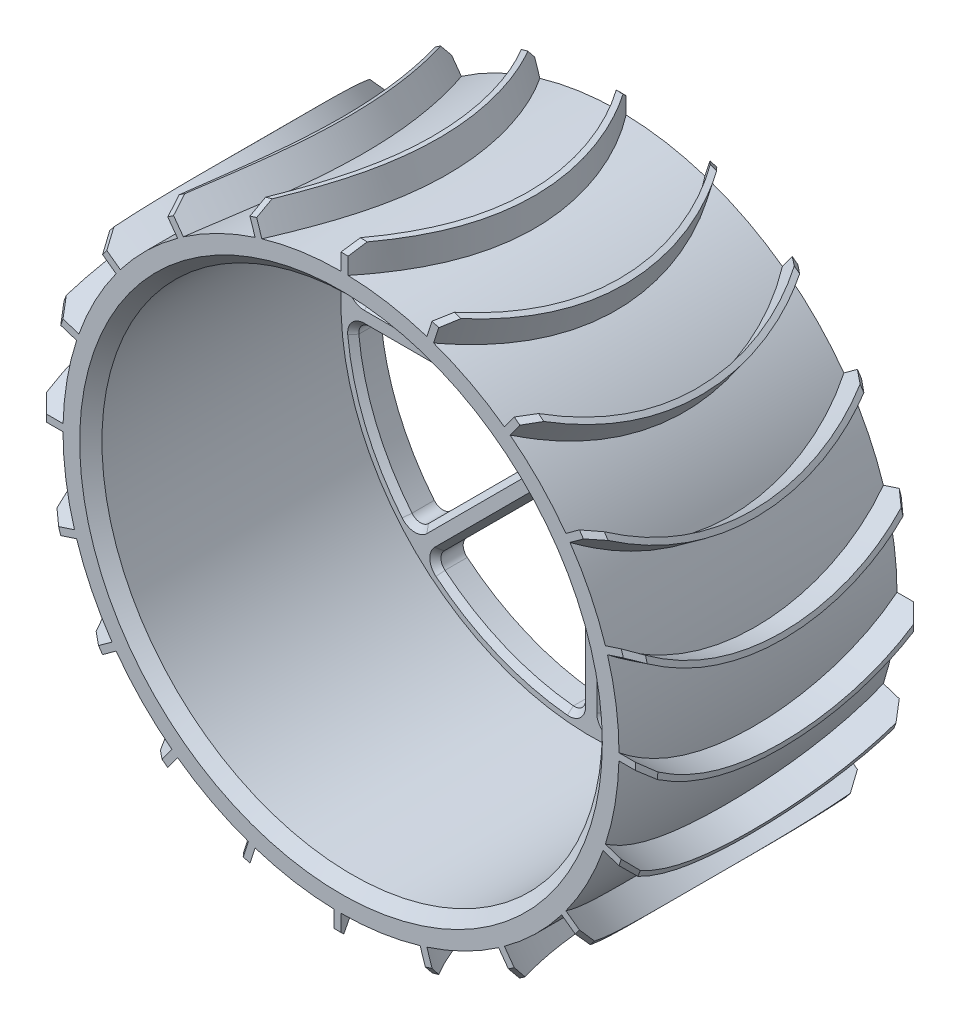
from build123d import *

# Parameters (mm, degrees)
SKETCH1_R                    = 50
BOSS_EXTRUDE1_DEPTH          = 25
BOSS_EXTRUDE2_REACH          = 77
BOSS_EXTRUDE2_END_RADIUS     = 55
CHAMFER1_SIZE                = 2
CIRPATTERN1_COUNT            = 20
CHAMFER1_OF_CIRPATTERN1_SIZE = 2
CUT_EXTRUDE1_DEPTH           = 82.673087038
CUT_EXTRUDE1_DEPTH_BACK      = 20
SKETCH4_R                    = 45
CUT_EXTRUDE2_DEPTH           = 82.673087038
CHAMFER2_SIZE                = 1
CIRPATTERN2_COUNT            = 8
CHAMFER2_OF_CIRPATTERN2_SIZE = 1
SKETCH2_R                    = 1.6
SKETCH2_R_2                  = 2.5
CUT_EXTRUDE3_DEPTH           = 82.673087038
CHAMFER3_SIZE                = 2
CHAMFER4_SIZE                = 1


with BuildPart() as part:
    # Sketch1 → Boss-Extrude1 (new, symmetric)
    with BuildSketch(Plane.XY):
        Circle(SKETCH1_R)
    extrude(amount=BOSS_EXTRUDE1_DEPTH, both=True)

    # Boss-Extrude2: up to this cylinder (the profile starts inside it)
    boss_extrude2_end = Plane(origin=(0, 0, 24.490535), z_dir=(0, 0, -1)) * Cylinder(BOSS_EXTRUDE2_END_RADIUS, 265, mode=Mode.PRIVATE)
    # Sketch3 → Boss-Extrude2 (add, up to the surface)
    with BuildSketch(Plane(origin=(0, 0, 0), x_dir=(1, 0, 0), z_dir=(0, 1, 0)), mode=Mode.PRIVATE) as boss_extrude2_sk1:
        with BuildLine():
            ThreePointArc((0, 25), (8.775010008, 0), (0, -25))
            Line((0, -25), (1.271163627, -25))
            ThreePointArc((1.271163627, -25), (9.775010008, 0), (1.271163627, 25))
            Line((1.271163627, 25), (0, 25))
        make_face()
    boss_extrude2_tool1 = extrude(boss_extrude2_sk1.sketch, amount=BOSS_EXTRUDE2_REACH, mode=Mode.PRIVATE) & boss_extrude2_end
    boss_extrude2 = boss_extrude2_tool1.solids().sort_by_distance((0.635582, 0, 24.490535))[0]
    add(boss_extrude2)

    # Chamfer1
    # the kernel refuses this chamfer: 2 mm, written as the material it takes off along each edge
    with BuildSketch(Plane(origin=(0, 0, -25), x_dir=(-0.0933795104694511, 0.9956305876300132, 0), z_dir=(-0.9956305876300132, -0.0933795104694511, 0))) as chamfer1_piece_1:
        Polygon((55, -CHAMFER1_SIZE), (55 - CHAMFER1_SIZE, 0), (55, 0), align=None)
    revolve(axis=Axis((0, 0, -25), (0, 0, -1)), revolution_arc=12.040457702, mode=Mode.SUBTRACT)
    with BuildSketch(Plane(origin=(0, 0, 25), x_dir=(-0.09337951046945088, 0.9956305876300133, 0), z_dir=(-0.9956305876300133, -0.09337951046945088, 0))) as chamfer1_piece_2:
        Polygon((55 - CHAMFER1_SIZE, 0), (55, CHAMFER1_SIZE), (55, 0), align=None)
    revolve(axis=Axis((0, 0, 25), (0, 0, -1)), revolution_arc=12.040457702, mode=Mode.SUBTRACT)

    # CirPattern1: Boss-Extrude2 ×20 about axis
    cirpattern1_axis = Axis((0, 0, 0), (0, 0, 1))
    for i in range(1, CIRPATTERN1_COUNT):
        add(boss_extrude2.rotate(cirpattern1_axis, i * 360 / CIRPATTERN1_COUNT))

    # Chamfer1 of CirPattern1
    # the kernel refuses this chamfer: 2 mm, written as the material it takes off along each edge
    with BuildSketch(Plane(origin=(0, 0, -25), x_dir=(-0.39647596361761267, 0.9180451025268234, 0), z_dir=(-0.9180451025268234, -0.39647596361761267, 0))) as chamfer1_of_cirpattern1_piece_1:
        Polygon((55, -CHAMFER1_OF_CIRPATTERN1_SIZE), (55 - CHAMFER1_OF_CIRPATTERN1_SIZE, 0), (55, 0), align=None)
    revolve(axis=Axis((0, 0, -25), (0, 0, -1)), revolution_arc=12.040457702, mode=Mode.SUBTRACT)
    with BuildSketch(Plane(origin=(0, 0, 25), x_dir=(-0.3964759636176123, 0.9180451025268235, 0), z_dir=(-0.9180451025268235, -0.3964759636176123, 0))) as chamfer1_of_cirpattern1_piece_2:
        Polygon((55 - CHAMFER1_OF_CIRPATTERN1_SIZE, 0), (55, CHAMFER1_OF_CIRPATTERN1_SIZE), (55, 0), align=None)
    revolve(axis=Axis((0, 0, 25), (0, 0, -1)), revolution_arc=12.040457702, mode=Mode.SUBTRACT)
    with BuildSketch(Plane(origin=(0, 0, -25), x_dir=(-0.6607625870364097, 0.7505949663919623, 0), z_dir=(-0.7505949663919623, -0.6607625870364097, 0))) as chamfer1_of_cirpattern1_piece_3:
        Polygon((55, -CHAMFER1_OF_CIRPATTERN1_SIZE), (55 - CHAMFER1_OF_CIRPATTERN1_SIZE, 0), (55, 0), align=None)
    revolve(axis=Axis((0, 0, -25), (0, 0, -1)), revolution_arc=12.040457702, mode=Mode.SUBTRACT)
    with BuildSketch(Plane(origin=(0, 0, 25), x_dir=(-0.6607625870364093, 0.7505949663919625, 0), z_dir=(-0.7505949663919625, -0.6607625870364093, 0))) as chamfer1_of_cirpattern1_piece_4:
        Polygon((55 - CHAMFER1_OF_CIRPATTERN1_SIZE, 0), (55, CHAMFER1_OF_CIRPATTERN1_SIZE), (55, 0), align=None)
    revolve(axis=Axis((0, 0, 25), (0, 0, -1)), revolution_arc=12.040457702, mode=Mode.SUBTRACT)
    with BuildSketch(Plane(origin=(0, 0, -25), x_dir=(-0.8603691646324303, 0.509671365244011, 0), z_dir=(-0.509671365244011, -0.8603691646324303, 0))) as chamfer1_of_cirpattern1_piece_5:
        Polygon((55, -CHAMFER1_OF_CIRPATTERN1_SIZE), (55 - CHAMFER1_OF_CIRPATTERN1_SIZE, 0), (55, 0), align=None)
    revolve(axis=Axis((0, 0, -25), (0, 0, -1)), revolution_arc=12.040457702, mode=Mode.SUBTRACT)
    with BuildSketch(Plane(origin=(0, 0, 25), x_dir=(-0.8603691646324301, 0.5096713652440111, 0), z_dir=(-0.5096713652440111, -0.8603691646324301, 0))) as chamfer1_of_cirpattern1_piece_6:
        Polygon((55 - CHAMFER1_OF_CIRPATTERN1_SIZE, 0), (55, CHAMFER1_OF_CIRPATTERN1_SIZE), (55, 0), align=None)
    revolve(axis=Axis((0, 0, 25), (0, 0, -1)), revolution_arc=12.040457702, mode=Mode.SUBTRACT)
    with BuildSketch(Plane(origin=(0, 0, -25), x_dir=(-0.9757568138497709, 0.2188575797767665, 0), z_dir=(-0.2188575797767665, -0.9757568138497709, 0))) as chamfer1_of_cirpattern1_piece_7:
        Polygon((55, -CHAMFER1_OF_CIRPATTERN1_SIZE), (55 - CHAMFER1_OF_CIRPATTERN1_SIZE, 0), (55, 0), align=None)
    revolve(axis=Axis((0, 0, -25), (0, 0, -1)), revolution_arc=12.040457702, mode=Mode.SUBTRACT)
    with BuildSketch(Plane(origin=(0, 0, 25), x_dir=(-0.9757568138497706, 0.2188575797767667, 0), z_dir=(-0.2188575797767667, -0.9757568138497706, 0))) as chamfer1_of_cirpattern1_piece_8:
        Polygon((55 - CHAMFER1_OF_CIRPATTERN1_SIZE, 0), (55, CHAMFER1_OF_CIRPATTERN1_SIZE), (55, 0), align=None)
    revolve(axis=Axis((0, 0, 25), (0, 0, -1)), revolution_arc=12.040457702, mode=Mode.SUBTRACT)
    with BuildSketch(Plane(origin=(0, 0, -25), x_dir=(-0.9956305876300132, -0.09337951046945099, 0), z_dir=(0.09337951046945099, -0.9956305876300132, 0))) as chamfer1_of_cirpattern1_piece_9:
        Polygon((55, -CHAMFER1_OF_CIRPATTERN1_SIZE), (55 - CHAMFER1_OF_CIRPATTERN1_SIZE, 0), (55, 0), align=None)
    revolve(axis=Axis((0, 0, -25), (0, 0, -1)), revolution_arc=12.040457702, mode=Mode.SUBTRACT)
    with BuildSketch(Plane(origin=(0, 0, 25), x_dir=(-0.9956305876300132, -0.09337951046945075, 0), z_dir=(0.09337951046945075, -0.9956305876300132, 0))) as chamfer1_of_cirpattern1_piece_10:
        Polygon((55 - CHAMFER1_OF_CIRPATTERN1_SIZE, 0), (55, CHAMFER1_OF_CIRPATTERN1_SIZE), (55, 0), align=None)
    revolve(axis=Axis((0, 0, 25), (0, 0, -1)), revolution_arc=12.040457702, mode=Mode.SUBTRACT)
    with BuildSketch(Plane(origin=(0, 0, -25), x_dir=(-0.9180451025268233, -0.39647596361761267, 0), z_dir=(0.39647596361761267, -0.9180451025268233, 0))) as chamfer1_of_cirpattern1_piece_11:
        Polygon((55, -CHAMFER1_OF_CIRPATTERN1_SIZE), (55 - CHAMFER1_OF_CIRPATTERN1_SIZE, 0), (55, 0), align=None)
    revolve(axis=Axis((0, 0, -25), (0, 0, -1)), revolution_arc=12.040457702, mode=Mode.SUBTRACT)
    with BuildSketch(Plane(origin=(0, 0, 25), x_dir=(-0.9180451025268236, -0.3964759636176123, 0), z_dir=(0.3964759636176123, -0.9180451025268236, 0))) as chamfer1_of_cirpattern1_piece_12:
        Polygon((55 - CHAMFER1_OF_CIRPATTERN1_SIZE, 0), (55, CHAMFER1_OF_CIRPATTERN1_SIZE), (55, 0), align=None)
    revolve(axis=Axis((0, 0, 25), (0, 0, -1)), revolution_arc=12.040457702, mode=Mode.SUBTRACT)
    with BuildSketch(Plane(origin=(0, 0, -25), x_dir=(-0.7505949663919622, -0.6607625870364099, 0), z_dir=(0.6607625870364099, -0.7505949663919622, 0))) as chamfer1_of_cirpattern1_piece_13:
        Polygon((55, -CHAMFER1_OF_CIRPATTERN1_SIZE), (55 - CHAMFER1_OF_CIRPATTERN1_SIZE, 0), (55, 0), align=None)
    revolve(axis=Axis((0, 0, -25), (0, 0, -1)), revolution_arc=12.040457702, mode=Mode.SUBTRACT)
    with BuildSketch(Plane(origin=(0, 0, 25), x_dir=(-0.7505949663919624, -0.6607625870364097, 0), z_dir=(0.6607625870364097, -0.7505949663919624, 0))) as chamfer1_of_cirpattern1_piece_14:
        Polygon((55 - CHAMFER1_OF_CIRPATTERN1_SIZE, 0), (55, CHAMFER1_OF_CIRPATTERN1_SIZE), (55, 0), align=None)
    revolve(axis=Axis((0, 0, 25), (0, 0, -1)), revolution_arc=12.040457702, mode=Mode.SUBTRACT)
    with BuildSketch(Plane(origin=(0, 0, -25), x_dir=(-0.5096713652440107, -0.8603691646324305, 0), z_dir=(0.8603691646324305, -0.5096713652440107, 0))) as chamfer1_of_cirpattern1_piece_15:
        Polygon((55, -CHAMFER1_OF_CIRPATTERN1_SIZE), (55 - CHAMFER1_OF_CIRPATTERN1_SIZE, 0), (55, 0), align=None)
    revolve(axis=Axis((0, 0, -25), (0, 0, -1)), revolution_arc=12.040457702, mode=Mode.SUBTRACT)
    with BuildSketch(Plane(origin=(0, 0, 25), x_dir=(-0.5096713652440111, -0.8603691646324303, 0), z_dir=(0.8603691646324303, -0.5096713652440111, 0))) as chamfer1_of_cirpattern1_piece_16:
        Polygon((55 - CHAMFER1_OF_CIRPATTERN1_SIZE, 0), (55, CHAMFER1_OF_CIRPATTERN1_SIZE), (55, 0), align=None)
    revolve(axis=Axis((0, 0, 25), (0, 0, -1)), revolution_arc=12.040457702, mode=Mode.SUBTRACT)
    with BuildSketch(Plane(origin=(0, 0, -25), x_dir=(-0.21885757977676654, -0.9757568138497709, 0), z_dir=(0.9757568138497709, -0.21885757977676654, 0))) as chamfer1_of_cirpattern1_piece_17:
        Polygon((55, -CHAMFER1_OF_CIRPATTERN1_SIZE), (55 - CHAMFER1_OF_CIRPATTERN1_SIZE, 0), (55, 0), align=None)
    revolve(axis=Axis((0, 0, -25), (0, 0, -1)), revolution_arc=12.040457702, mode=Mode.SUBTRACT)
    with BuildSketch(Plane(origin=(0, 0, 25), x_dir=(-0.21885757977676693, -0.9757568138497708, 0), z_dir=(0.9757568138497708, -0.21885757977676693, 0))) as chamfer1_of_cirpattern1_piece_18:
        Polygon((55 - CHAMFER1_OF_CIRPATTERN1_SIZE, 0), (55, CHAMFER1_OF_CIRPATTERN1_SIZE), (55, 0), align=None)
    revolve(axis=Axis((0, 0, 25), (0, 0, -1)), revolution_arc=12.040457702, mode=Mode.SUBTRACT)
    with BuildSketch(Plane(origin=(0, 0, -25), x_dir=(0.09337951046945098, -0.9956305876300133, 0), z_dir=(0.9956305876300133, 0.09337951046945098, 0))) as chamfer1_of_cirpattern1_piece_19:
        Polygon((55, -CHAMFER1_OF_CIRPATTERN1_SIZE), (55 - CHAMFER1_OF_CIRPATTERN1_SIZE, 0), (55, 0), align=None)
    revolve(axis=Axis((0, 0, -25), (0, 0, -1)), revolution_arc=12.040457702, mode=Mode.SUBTRACT)
    with BuildSketch(Plane(origin=(0, 0, 25), x_dir=(0.09337951046945075, -0.9956305876300133, 0), z_dir=(0.9956305876300133, 0.09337951046945075, 0))) as chamfer1_of_cirpattern1_piece_20:
        Polygon((55 - CHAMFER1_OF_CIRPATTERN1_SIZE, 0), (55, CHAMFER1_OF_CIRPATTERN1_SIZE), (55, 0), align=None)
    revolve(axis=Axis((0, 0, 25), (0, 0, -1)), revolution_arc=12.040457702, mode=Mode.SUBTRACT)
    with BuildSketch(Plane(origin=(0, 0, -25), x_dir=(0.39647596361761245, -0.9180451025268234, 0), z_dir=(0.9180451025268234, 0.39647596361761245, 0))) as chamfer1_of_cirpattern1_piece_21:
        Polygon((55, -CHAMFER1_OF_CIRPATTERN1_SIZE), (55 - CHAMFER1_OF_CIRPATTERN1_SIZE, 0), (55, 0), align=None)
    revolve(axis=Axis((0, 0, -25), (0, 0, -1)), revolution_arc=12.040457702, mode=Mode.SUBTRACT)
    with BuildSketch(Plane(origin=(0, 0, 25), x_dir=(0.39647596361761206, -0.9180451025268236, 0), z_dir=(0.9180451025268236, 0.39647596361761206, 0))) as chamfer1_of_cirpattern1_piece_22:
        Polygon((55 - CHAMFER1_OF_CIRPATTERN1_SIZE, 0), (55, CHAMFER1_OF_CIRPATTERN1_SIZE), (55, 0), align=None)
    revolve(axis=Axis((0, 0, 25), (0, 0, -1)), revolution_arc=12.040457702, mode=Mode.SUBTRACT)
    with BuildSketch(Plane(origin=(0, 0, -25), x_dir=(0.66076258703641, -0.750594966391962, 0), z_dir=(0.750594966391962, 0.66076258703641, 0))) as chamfer1_of_cirpattern1_piece_23:
        Polygon((55, -CHAMFER1_OF_CIRPATTERN1_SIZE), (55 - CHAMFER1_OF_CIRPATTERN1_SIZE, 0), (55, 0), align=None)
    revolve(axis=Axis((0, 0, -25), (0, 0, -1)), revolution_arc=12.040457702, mode=Mode.SUBTRACT)
    with BuildSketch(Plane(origin=(0, 0, 25), x_dir=(0.6607625870364097, -0.7505949663919624, 0), z_dir=(0.7505949663919624, 0.6607625870364097, 0))) as chamfer1_of_cirpattern1_piece_24:
        Polygon((55 - CHAMFER1_OF_CIRPATTERN1_SIZE, 0), (55, CHAMFER1_OF_CIRPATTERN1_SIZE), (55, 0), align=None)
    revolve(axis=Axis((0, 0, 25), (0, 0, -1)), revolution_arc=12.040457702, mode=Mode.SUBTRACT)
    with BuildSketch(Plane(origin=(0, 0, -25), x_dir=(0.86036916463243, -0.5096713652440115, 0), z_dir=(0.5096713652440115, 0.86036916463243, 0))) as chamfer1_of_cirpattern1_piece_25:
        Polygon((55, -CHAMFER1_OF_CIRPATTERN1_SIZE), (55 - CHAMFER1_OF_CIRPATTERN1_SIZE, 0), (55, 0), align=None)
    revolve(axis=Axis((0, 0, -25), (0, 0, -1)), revolution_arc=12.040457702, mode=Mode.SUBTRACT)
    with BuildSketch(Plane(origin=(0, 0, 25), x_dir=(0.8603691646324296, -0.509671365244012, 0), z_dir=(0.509671365244012, 0.8603691646324296, 0))) as chamfer1_of_cirpattern1_piece_26:
        Polygon((55 - CHAMFER1_OF_CIRPATTERN1_SIZE, 0), (55, CHAMFER1_OF_CIRPATTERN1_SIZE), (55, 0), align=None)
    revolve(axis=Axis((0, 0, 25), (0, 0, -1)), revolution_arc=12.040457702, mode=Mode.SUBTRACT)
    with BuildSketch(Plane(origin=(0, 0, -25), x_dir=(0.9757568138497709, -0.2188575797767665, 0), z_dir=(0.2188575797767665, 0.9757568138497709, 0))) as chamfer1_of_cirpattern1_piece_27:
        Polygon((55, -CHAMFER1_OF_CIRPATTERN1_SIZE), (55 - CHAMFER1_OF_CIRPATTERN1_SIZE, 0), (55, 0), align=None)
    revolve(axis=Axis((0, 0, -25), (0, 0, -1)), revolution_arc=12.040457702, mode=Mode.SUBTRACT)
    with BuildSketch(Plane(origin=(0, 0, 25), x_dir=(0.9757568138497706, -0.2188575797767667, 0), z_dir=(0.2188575797767667, 0.9757568138497706, 0))) as chamfer1_of_cirpattern1_piece_28:
        Polygon((55 - CHAMFER1_OF_CIRPATTERN1_SIZE, 0), (55, CHAMFER1_OF_CIRPATTERN1_SIZE), (55, 0), align=None)
    revolve(axis=Axis((0, 0, 25), (0, 0, -1)), revolution_arc=12.040457702, mode=Mode.SUBTRACT)
    with BuildSketch(Plane(origin=(0, 0, -25), x_dir=(0.9956305876300132, 0.09337951046945087, 0), z_dir=(-0.09337951046945087, 0.9956305876300132, 0))) as chamfer1_of_cirpattern1_piece_29:
        Polygon((55, -CHAMFER1_OF_CIRPATTERN1_SIZE), (55 - CHAMFER1_OF_CIRPATTERN1_SIZE, 0), (55, 0), align=None)
    revolve(axis=Axis((0, 0, -25), (0, 0, -1)), revolution_arc=12.040457702, mode=Mode.SUBTRACT)
    with BuildSketch(Plane(origin=(0, 0, 25), x_dir=(0.9956305876300133, 0.09337951046945066, 0), z_dir=(-0.09337951046945066, 0.9956305876300133, 0))) as chamfer1_of_cirpattern1_piece_30:
        Polygon((55 - CHAMFER1_OF_CIRPATTERN1_SIZE, 0), (55, CHAMFER1_OF_CIRPATTERN1_SIZE), (55, 0), align=None)
    revolve(axis=Axis((0, 0, 25), (0, 0, -1)), revolution_arc=12.040457702, mode=Mode.SUBTRACT)
    with BuildSketch(Plane(origin=(0, 0, -25), x_dir=(0.9180451025268233, 0.3964759636176124, 0), z_dir=(-0.3964759636176124, 0.9180451025268233, 0))) as chamfer1_of_cirpattern1_piece_31:
        Polygon((55, -CHAMFER1_OF_CIRPATTERN1_SIZE), (55 - CHAMFER1_OF_CIRPATTERN1_SIZE, 0), (55, 0), align=None)
    revolve(axis=Axis((0, 0, -25), (0, 0, -1)), revolution_arc=12.040457702, mode=Mode.SUBTRACT)
    with BuildSketch(Plane(origin=(0, 0, 25), x_dir=(0.9180451025268237, 0.39647596361761206, 0), z_dir=(-0.39647596361761206, 0.9180451025268237, 0))) as chamfer1_of_cirpattern1_piece_32:
        Polygon((55 - CHAMFER1_OF_CIRPATTERN1_SIZE, 0), (55, CHAMFER1_OF_CIRPATTERN1_SIZE), (55, 0), align=None)
    revolve(axis=Axis((0, 0, 25), (0, 0, -1)), revolution_arc=12.040457702, mode=Mode.SUBTRACT)
    with BuildSketch(Plane(origin=(0, 0, -25), x_dir=(0.7505949663919622, 0.6607625870364099, 0), z_dir=(-0.6607625870364099, 0.7505949663919622, 0))) as chamfer1_of_cirpattern1_piece_33:
        Polygon((55, -CHAMFER1_OF_CIRPATTERN1_SIZE), (55 - CHAMFER1_OF_CIRPATTERN1_SIZE, 0), (55, 0), align=None)
    revolve(axis=Axis((0, 0, -25), (0, 0, -1)), revolution_arc=12.040457702, mode=Mode.SUBTRACT)
    with BuildSketch(Plane(origin=(0, 0, 25), x_dir=(0.7505949663919625, 0.6607625870364096, 0), z_dir=(-0.6607625870364096, 0.7505949663919625, 0))) as chamfer1_of_cirpattern1_piece_34:
        Polygon((55 - CHAMFER1_OF_CIRPATTERN1_SIZE, 0), (55, CHAMFER1_OF_CIRPATTERN1_SIZE), (55, 0), align=None)
    revolve(axis=Axis((0, 0, 25), (0, 0, -1)), revolution_arc=12.040457702, mode=Mode.SUBTRACT)
    with BuildSketch(Plane(origin=(0, 0, -25), x_dir=(0.5096713652440115, 0.86036916463243, 0), z_dir=(-0.86036916463243, 0.5096713652440115, 0))) as chamfer1_of_cirpattern1_piece_35:
        Polygon((55, -CHAMFER1_OF_CIRPATTERN1_SIZE), (55 - CHAMFER1_OF_CIRPATTERN1_SIZE, 0), (55, 0), align=None)
    revolve(axis=Axis((0, 0, -25), (0, 0, -1)), revolution_arc=12.040457702, mode=Mode.SUBTRACT)
    with BuildSketch(Plane(origin=(0, 0, 25), x_dir=(0.509671365244012, 0.8603691646324296, 0), z_dir=(-0.8603691646324296, 0.509671365244012, 0))) as chamfer1_of_cirpattern1_piece_36:
        Polygon((55 - CHAMFER1_OF_CIRPATTERN1_SIZE, 0), (55, CHAMFER1_OF_CIRPATTERN1_SIZE), (55, 0), align=None)
    revolve(axis=Axis((0, 0, 25), (0, 0, -1)), revolution_arc=12.040457702, mode=Mode.SUBTRACT)
    with BuildSketch(Plane(origin=(0, 0, -25), x_dir=(0.21885757977676662, 0.9757568138497708, 0), z_dir=(-0.9757568138497708, 0.21885757977676662, 0))) as chamfer1_of_cirpattern1_piece_37:
        Polygon((55 - CHAMFER1_OF_CIRPATTERN1_SIZE, 0), (55, -CHAMFER1_OF_CIRPATTERN1_SIZE), (55, 0), align=None)
    revolve(axis=Axis((0, 0, -25), (0, 0, -1)), revolution_arc=12.040457702, mode=Mode.SUBTRACT)
    with BuildSketch(Plane(origin=(0, 0, 25), x_dir=(0.21885757977676687, 0.9757568138497709, 0), z_dir=(-0.9757568138497709, 0.21885757977676687, 0))) as chamfer1_of_cirpattern1_piece_38:
        Polygon((55 - CHAMFER1_OF_CIRPATTERN1_SIZE, 0), (55, CHAMFER1_OF_CIRPATTERN1_SIZE), (55, 0), align=None)
    revolve(axis=Axis((0, 0, 25), (0, 0, -1)), revolution_arc=12.040457702, mode=Mode.SUBTRACT)

    # Sketch4 → Cut-Extrude1 (cut, two sides: drawn at the far end of the back side and taken through both)
    with BuildSketch(Plane.XY.offset(-CUT_EXTRUDE1_DEPTH_BACK)):
        Circle(SKETCH4_R)
    extrude(amount=CUT_EXTRUDE1_DEPTH + CUT_EXTRUDE1_DEPTH_BACK, mode=Mode.SUBTRACT)

    # Sketch4<3> → Cut-Extrude2 (cut, through all)
    with BuildSketch(Plane.XY):
        with BuildLine():
            ThreePointArc((-27.294144039, 33.226942399), (-16.455387592, 39.726819898), (-4.195121951, 42.794870625))
            ThreePointArc((-4.195121951, 42.794870625), (-2.656542502, 42.286005921), (-2, 40.804411526))
            Line((-2, 40.804411526), (-2, 14.485281374))
            ThreePointArc((-2, 14.485281374), (-4.469266271, 10.789763244), (-8.828427125, 11.656854249))
            Line((-8.828427125, 11.656854249), (-27.43886253, 30.267289655))
            ThreePointArc((-27.43886253, 30.267289655), (-28.022262318, 31.779180754), (-27.294144039, 33.226942399))
        make_face()
    cut_extrude2 = extrude(amount=-CUT_EXTRUDE2_DEPTH, mode=Mode.SUBTRACT)

    # Chamfer2
    chamfer2_edges = [part.edges().sort_by_distance(p)[0] for p in [
        (-28.022262318, 31.779180754, -20),
        (-18.133644827, 20.962071952, -20),
        (-4.469266271, 10.789763244, -20),
        (-2, 27.64484645, -20),
        (-2.656542502, 42.286005921, -20),
        (-16.455387592, 39.726819898, -20),
    ]]
    chamfer(chamfer2_edges, length=CHAMFER2_SIZE)

    # CirPattern2: Cut-Extrude2 ×8 about axis
    cirpattern2_axis = Axis((0, 0, 0), (0, 0, 1))
    for i in range(1, CIRPATTERN2_COUNT):
        add(cut_extrude2.rotate(cirpattern2_axis, i * 360 / CIRPATTERN2_COUNT), mode=Mode.SUBTRACT)

    # Chamfer2 of CirPattern2
    chamfer2_of_cirpattern2_edges = [part.edges().sort_by_distance(p)[0] for p in [
        (-42.286005921, 2.656542502, -20),
        (-27.64484645, 2, -20),
        (-10.789763244, 4.469266271, -20),
        (-20.962071952, 18.133644827, -20),
        (-31.779180754, 28.022262318, -20),
        (-39.726819898, 16.455387592, -20),
        (-31.779180754, -28.022262318, -20),
        (-20.962071952, -18.133644827, -20),
        (-10.789763244, -4.469266271, -20),
        (-27.64484645, -2, -20),
        (-42.286005921, -2.656542502, -20),
        (-39.726819898, -16.455387592, -20),
        (-2.656542502, -42.286005921, -20),
        (-2, -27.64484645, -20),
        (-4.469266271, -10.789763244, -20),
        (-18.133644827, -20.962071952, -20),
        (-28.022262318, -31.779180754, -20),
        (-16.455387592, -39.726819898, -20),
        (28.022262318, -31.779180754, -20),
        (18.133644827, -20.962071952, -20),
        (4.469266271, -10.789763244, -20),
        (2, -27.64484645, -20),
        (2.656542502, -42.286005921, -20),
        (16.455387592, -39.726819898, -20),
        (42.286005921, -2.656542502, -20),
        (27.64484645, -2, -20),
        (10.789763244, -4.469266271, -20),
        (20.962071952, -18.133644827, -20),
        (31.779180754, -28.022262318, -20),
        (39.726819898, -16.455387592, -20),
        (31.779180754, 28.022262318, -20),
        (20.962071952, 18.133644827, -20),
        (10.789763244, 4.469266271, -20),
        (27.64484645, 2, -20),
        (42.286005921, 2.656542502, -20),
        (39.726819898, 16.455387592, -20),
        (2.656542502, 42.286005921, -20),
        (2, 27.64484645, -20),
        (4.469266271, 10.789763244, -20),
        (18.133644827, 20.962071952, -20),
        (28.022262318, 31.779180754, -20),
        (16.455387592, 39.726819898, -20),
    ]]
    chamfer(chamfer2_of_cirpattern2_edges, length=CHAMFER2_OF_CIRPATTERN2_SIZE)

    # Sketch2 → Cut-Extrude3 (cut, through all)
    with BuildSketch(Plane.XY):
        with Locations((5.5, 5.5)):
            Circle(SKETCH2_R)
        with Locations((-5.5, 5.5)):
            Circle(SKETCH2_R)
        with Locations((-5.5, -5.5)):
            Circle(SKETCH2_R)
        with Locations((5.5, -5.5)):
            Circle(SKETCH2_R)
        Circle(SKETCH2_R_2)
    extrude(amount=-CUT_EXTRUDE3_DEPTH, mode=Mode.SUBTRACT)

    # Chamfer3
    chamfer3_edges = [part.edges().sort_by_distance(p)[0] for p in [
        (-45, 0, 25),
    ]]
    chamfer(chamfer3_edges, length=CHAMFER3_SIZE)

    # Chamfer4
    chamfer4_edges = [part.edges().sort_by_distance(p)[0] for p in [
        (-2.5, 0, -20),
    ]]
    chamfer(chamfer4_edges, length=CHAMFER4_SIZE)


solid = part.part
